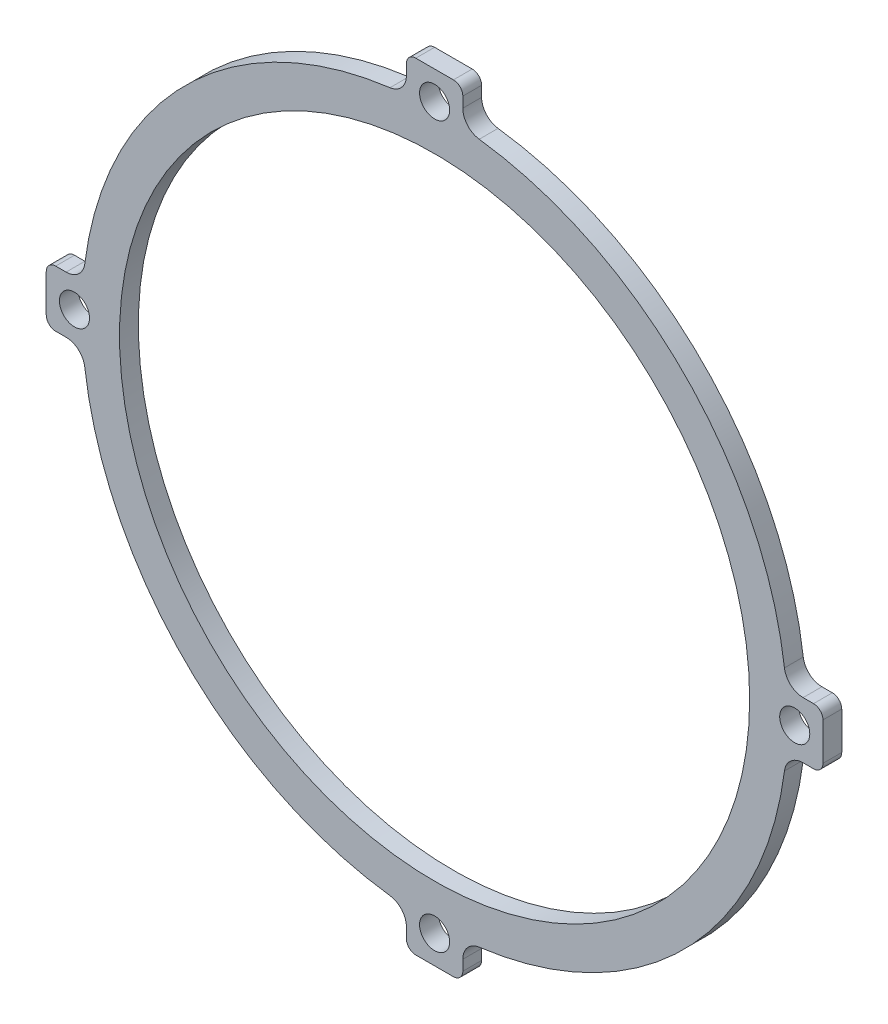
from build123d import *

# Parameters (mm, degrees)
SKETCH_1_R          = 1.6
EXTRUDE_1_DEPTH     = 2
SKETCH_3_R          = 4.5
SKETCH_3_R_2        = 1.25
CUT_EXTRUDE_1_DEPTH = 59.429442304
CUT_EXTRUDE_2_DEPTH = 59.429442304
FILLET_1_R          = 1
SKETCH_5_R          = 33.5
CUT_EXTRUDE_3_DEPTH = 59.429442304


with BuildPart() as part:
    # ｽｹｯﾁ1 → ﾎﾞｽ - 押し出し1 (new body)
    with BuildSketch(Plane.XY):
        with BuildLine():
            Line((-3, -39.182266397), (-3, -41.291643997))
            Line((-3, -41.291643997), (3, -41.291643997))
            Line((3, -41.291643997), (3, -39.182266397))
            ThreePointArc((3, -39.182266397), (3.498945518, -37.860587373), (4.746835443, -37.198354174))
            ThreePointArc((4.746835443, -37.198354174), (26.516504294, -26.516504294), (37.198354174, -4.746835443))
            ThreePointArc((37.198354174, -4.746835443), (37.860587373, -3.498945518), (39.182266397, -3))
            Line((39.182266397, -3), (41.291643997, -3))
            Line((41.291643997, -3), (41.291643997, 3))
            Line((41.291643997, 3), (39.182266397, 3))
            ThreePointArc((39.182266397, 3), (37.860587373, 3.498945518), (37.198354174, 4.746835443))
            ThreePointArc((37.198354174, 4.746835443), (26.516504294, 26.516504294), (4.746835443, 37.198354174))
            ThreePointArc((4.746835443, 37.198354174), (3.498945518, 37.860587373), (3, 39.182266397))
            Line((3, 39.182266397), (3, 41.291643997))
            Line((3, 41.291643997), (-3, 41.291643997))
            Line((-3, 41.291643997), (-3, 39.182266397))
            ThreePointArc((-3, 39.182266397), (-3.498945518, 37.860587373), (-4.746835443, 37.198354174))
            ThreePointArc((-4.746835443, 37.198354174), (-26.516504294, 26.516504294), (-37.198354174, 4.746835443))
            ThreePointArc((-37.198354174, 4.746835443), (-37.860587373, 3.498945518), (-39.182266397, 3))
            Line((-39.182266397, 3), (-41.291643997, 3))
            Line((-41.291643997, 3), (-41.291643997, -3))
            Line((-41.291643997, -3), (-39.182266397, -3))
            ThreePointArc((-39.182266397, -3), (-37.860587373, -3.498945518), (-37.198354174, -4.746835443))
            ThreePointArc((-37.198354174, -4.746835443), (-26.516504294, -26.516504294), (-4.746835443, -37.198354174))
            ThreePointArc((-4.746835443, -37.198354174), (-3.498945518, -37.860587373), (-3, -39.182266397))
        make_face()
        with Locations((-38.291643997, 0)):
            Circle(SKETCH_1_R, mode=Mode.SUBTRACT)
        with Locations((0, -38.291643997)):
            Circle(SKETCH_1_R, mode=Mode.SUBTRACT)
        with Locations((0, 38.291643997)):
            Circle(SKETCH_1_R, mode=Mode.SUBTRACT)
        with Locations((38.291643997, 0)):
            Circle(SKETCH_1_R, mode=Mode.SUBTRACT)
    extrude(amount=EXTRUDE_1_DEPTH)

    # ｽｹｯﾁ3 → ｶｯﾄ - 押し出し1 (cut, through all)
    with BuildSketch(Plane.XY.offset(2)):
        Circle(SKETCH_3_R)
        with Locations((0, 8.5)):
            Circle(SKETCH_3_R_2)
        with Locations((8.5, 0)):
            Circle(SKETCH_3_R_2)
        with Locations((0, -8.5)):
            Circle(SKETCH_3_R_2)
        with Locations((-8.5, 0)):
            Circle(SKETCH_3_R_2)
    extrude(amount=-CUT_EXTRUDE_1_DEPTH, mode=Mode.SUBTRACT)

    # ｽｹｯﾁ4 → ｶｯﾄ - 押し出し2 (cut, through all)
    with BuildSketch(Plane.XY.offset(2)):
        with BuildLine():
            Line((-3, 33.365401241), (-3, 12.1346611))
            ThreePointArc((-3, 12.1346611), (-8.838834765, 8.838834765), (-12.1346611, 3))
            Line((-12.1346611, 3), (-33.365401241, 3))
            ThreePointArc((-33.365401241, 3), (-23.68807717, 23.68807717), (-3, 33.365401241))
        make_face()
        with BuildLine():
            Line((3, 33.365401241), (3, 12.1346611))
            ThreePointArc((3, 12.1346611), (8.838834765, 8.838834765), (12.1346611, 3))
            Line((12.1346611, 3), (33.365401241, 3))
            ThreePointArc((33.365401241, 3), (23.68807717, 23.68807717), (3, 33.365401241))
        make_face()
        with BuildLine():
            Line((33.365401241, -3), (12.1346611, -3))
            ThreePointArc((12.1346611, -3), (8.838834765, -8.838834765), (3, -12.1346611))
            Line((3, -12.1346611), (3, -33.365401241))
            ThreePointArc((3, -33.365401241), (23.68807717, -23.68807717), (33.365401241, -3))
        make_face()
        with BuildLine():
            Line((-3, -33.365401241), (-3, -12.1346611))
            ThreePointArc((-3, -12.1346611), (-8.838834765, -8.838834765), (-12.1346611, -3))
            Line((-12.1346611, -3), (-33.365401241, -3))
            ThreePointArc((-33.365401241, -3), (-23.68807717, -23.68807717), (-3, -33.365401241))
        make_face()
    extrude(amount=-CUT_EXTRUDE_2_DEPTH, mode=Mode.SUBTRACT)

    # ﾌｨﾚｯﾄ1
    fillet_1_edges = [part.edges().sort_by_distance(p)[0] for p in [
        (41.291643997, 3, 1),
        (41.291643997, -3, 1),
        (3, -41.291643997, 1),
        (-3, -41.291643997, 1),
        (-41.291643997, -3, 1),
        (-41.291643997, 3, 1),
        (-3, 41.291643997, 1),
        (3, 41.291643997, 1),
    ]]
    fillet(fillet_1_edges, radius=FILLET_1_R)

    # ｽｹｯﾁ5 → ｶｯﾄ - 押し出し3 (cut, through all)
    with BuildSketch(Plane.XY.offset(2)):
        Circle(SKETCH_5_R)
    extrude(amount=-CUT_EXTRUDE_3_DEPTH, mode=Mode.SUBTRACT)


solid = part.part
